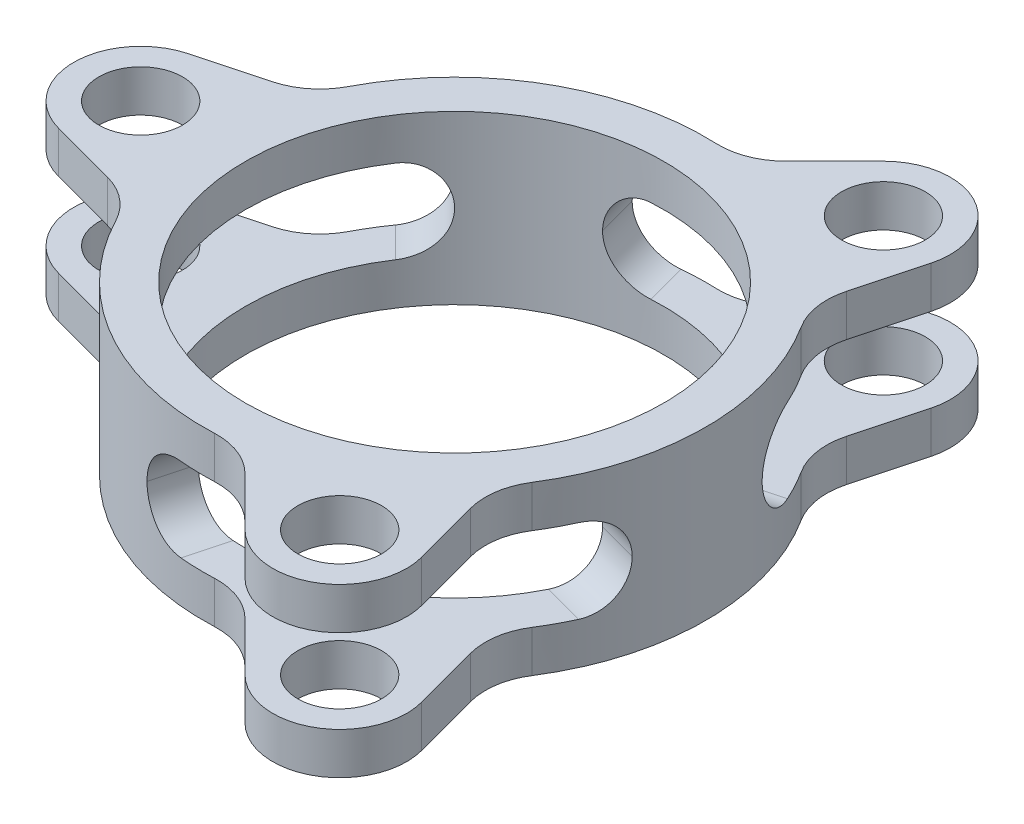
from build123d import *

# Parameters (mm, degrees)
SKETCH1_R                 = 5
SKETCH1_R_2               = 25
BOSS_EXTRUDE1_DEPTH       = 20
FILLET1_R                 = 8
CUT_EXTRUDE4_START        = 5
CUT_EXTRUDE4_DEPTH        = 10
FILLET3_R                 = 5
CIRPATTERN14_COUNT        = 3
FILLET3_OF_CIRPATTERN14_R = 5


with BuildPart() as part:
    # Sketch1 → Boss-Extrude1 (new body)
    with BuildSketch(Plane(origin=(0, 0, 0), x_dir=(1, 0, 0), z_dir=(0, 1, 0))):
        with BuildLine():
            ThreePointArc((13.093145751, -38.132806891), (22.75, -39.404155872), (26.47740661, -30.405400281))
            Line((26.47740661, -30.405400281), (23.370465731, -18.810139062))
            ThreePointArc((23.370465731, -18.810139062), (30, 0), (23.370465731, 18.810139062))
            Line((23.370465731, 18.810139062), (26.47740661, 30.405400281))
            ThreePointArc((26.47740661, 30.405400281), (22.75, 39.404155872), (13.093145751, 38.132806891))
            Line((13.093145751, 38.132806891), (4.604825411, 29.644486552))
            ThreePointArc((4.604825411, 29.644486552), (-15, 25.980762114), (-27.975291142, 10.83434749))
            Line((-27.975291142, 10.83434749), (-39.570552361, 7.72740661))
            ThreePointArc((-39.570552361, 7.72740661), (-45.5, 0), (-39.570552361, -7.72740661))
            Line((-39.570552361, -7.72740661), (-27.975291142, -10.83434749))
            ThreePointArc((-27.975291142, -10.83434749), (-15, -25.980762114), (4.604825411, -29.644486552))
            Line((4.604825411, -29.644486552), (13.093145751, -38.132806891))
        make_face()
        with Locations(Location((-37.5, 0, 0), (0, 0, 270))):
            Circle(SKETCH1_R, mode=Mode.SUBTRACT)
        with Locations(Location((18.75, -32.475952642, 0), (0, 0, 270))):
            Circle(SKETCH1_R, mode=Mode.SUBTRACT)
        with Locations(Location((0, 0, 0), (0, 0, 270))):
            Circle(SKETCH1_R_2, mode=Mode.SUBTRACT)
        with Locations(Location((18.75, 32.475952642, 0), (0, 0, 270))):
            Circle(SKETCH1_R, mode=Mode.SUBTRACT)
    extrude(amount=BOSS_EXTRUDE1_DEPTH)

    # Fillet1
    fillet1_edges = [part.edges().sort_by_distance(p)[0] for p in [
        (-27.975291142, 10, -10.83434749),
        (4.604825411, 10, -29.644486552),
        (23.370465731, 10, -18.810139062),
        (23.370465731, 10, 18.810139062),
        (4.604825411, 10, 29.644486552),
        (-27.975291142, 10, 10.83434749),
    ]]
    fillet(fillet1_edges, radius=FILLET1_R)

    # Sketch8 → Cut-Extrude4 (cut)
    with BuildSketch(Plane(origin=(0, 0, 0), x_dir=(1, 0, 0), z_dir=(0, 1, 0)).offset(CUT_EXTRUDE4_START)):
        Polygon((0, 0), (-50.700722077, 50.700722077), (-50.700722077, -50.700722077), align=None)
    cut_extrude4 = extrude(amount=CUT_EXTRUDE4_DEPTH, mode=Mode.SUBTRACT)

    # Fillet3
    fillet3_edges = [part.edges().sort_by_distance(p)[0] for p in [
        (-19.445436483, 15, -19.445436483),
        (-19.445436483, 15, 19.445436483),
        (-19.445436483, 5, 19.445436483),
        (-19.445436483, 5, -19.445436483),
    ]]
    fillet(fillet3_edges, radius=FILLET3_R - 0.0001)  # a hair under: the kernel refuses the full size

    # CirPattern14: Cut-Extrude4 ×3 about axis
    cirpattern14_axis = Axis((0, 20, 0), (0, -1, 0))
    for i in range(1, CIRPATTERN14_COUNT):
        add(cut_extrude4.rotate(cirpattern14_axis, i * 360 / CIRPATTERN14_COUNT), mode=Mode.SUBTRACT)

    # Fillet3 of CirPattern14
    fillet3_of_cirpattern14_edges = [part.edges().sort_by_distance(p)[0] for p in [
        (26.562960223, 15, -7.11752374),
        (-7.11752374, 15, -26.562960223),
        (-7.11752374, 5, -26.562960223),
        (26.562960223, 5, -7.11752374),
        (-7.11752374, 15, 26.562960223),
        (26.562960223, 15, 7.11752374),
        (26.562960223, 5, 7.11752374),
        (-7.11752374, 5, 26.562960223),
    ]]
    fillet(fillet3_of_cirpattern14_edges, radius=FILLET3_OF_CIRPATTERN14_R - 0.0001)  # a hair under: the kernel refuses the full size


solid = part.part
